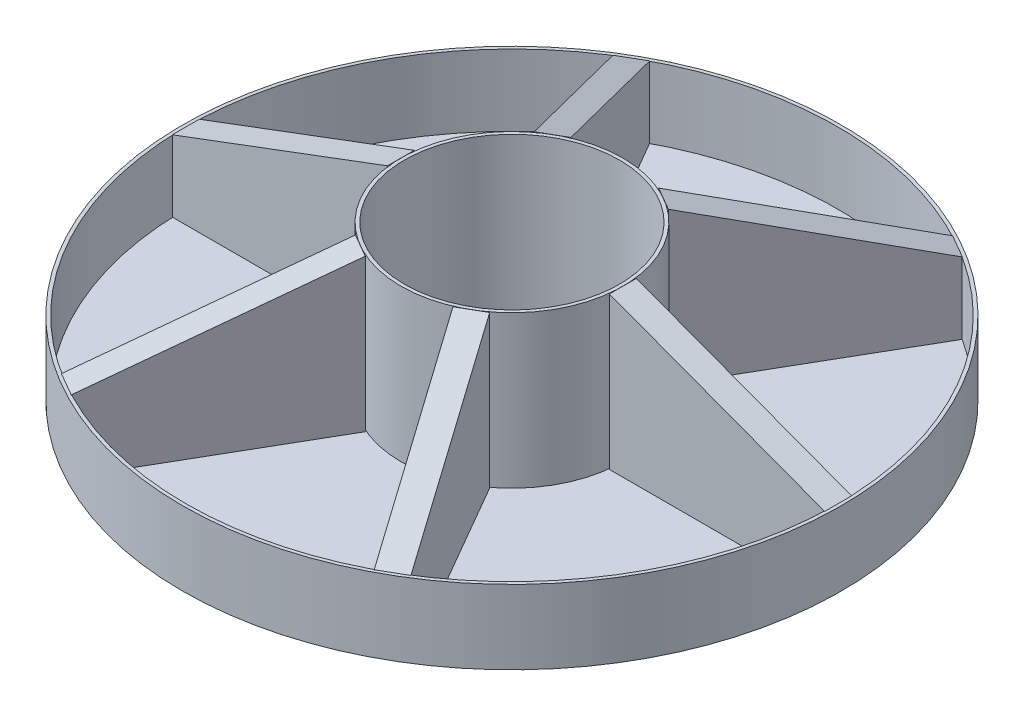
from build123d import *

# Parameters (mm, degrees)
SKETCH1_R           = 4.125
SKETCH1_R_2         = 4
BOSS_EXTRUDE1_DEPTH = 5.75
SKETCH1_4_R         = 12.25
SKETCH1_4_R_2       = 12.125
BOSS_EXTRUDE2_DEPTH = 2.75
SKETCH1_5_R         = 12.125
SKETCH1_5_R_2       = 4.125
BOSS_EXTRUDE3_DEPTH = 0.1
BOSS_EXTRUDE5_DEPTH = 0.5
CIRPATTERN4_COUNT   = 6


with BuildPart() as part:
    # Sketch1 → Boss-Extrude1 (new body)
    with BuildSketch(Plane(origin=(0, 0, 0), x_dir=(1, 0, 0), z_dir=(0, 1, 0))):
        Circle(SKETCH1_R)
        Circle(SKETCH1_R_2, mode=Mode.SUBTRACT)
    extrude(amount=BOSS_EXTRUDE1_DEPTH)



with BuildPart() as body_2:
    # Sketch1<4> → Boss-Extrude2 (new body)
    with BuildSketch(Plane(origin=(0, 0, 0), x_dir=(1, 0, 0), z_dir=(0, 1, 0))):
        Circle(SKETCH1_4_R)
        Circle(SKETCH1_4_R_2, mode=Mode.SUBTRACT)
    extrude(amount=BOSS_EXTRUDE2_DEPTH)


with BuildPart() as part_1:
    add(part.part)

    add(body_2.part)  # Boss-Extrude3 merges body 2
    # Sketch1<5> → Boss-Extrude3 (add)
    with BuildSketch(Plane(origin=(0, 0, 0), x_dir=(1, 0, 0), z_dir=(0, 1, 0))):
        Circle(SKETCH1_5_R)
        Circle(SKETCH1_5_R_2, mode=Mode.SUBTRACT)
    extrude(amount=BOSS_EXTRUDE3_DEPTH)


with BuildPart() as body_2_2:
    # Sketch7 → Boss-Extrude5 (new, symmetric)
    with BuildSketch(Plane.XY):
        Polygon((-4.125, 0.1), (-4.125, 5.75), (-12.125, 2.75), (-12.125, 0.1), align=None)
    extrude(amount=BOSS_EXTRUDE5_DEPTH, both=True)


with BuildPart() as cirpattern4_1:
    # CirPattern4: pattern copy
    add(body_2_2.part.rotate(Axis((0, 5.75, 0), (0, 1, 0)), 1 * 360 / CIRPATTERN4_COUNT))


with BuildPart() as cirpattern4_2:
    # CirPattern4: pattern copy
    add(body_2_2.part.rotate(Axis((0, 5.75, 0), (0, 1, 0)), 2 * 360 / CIRPATTERN4_COUNT))


with BuildPart() as cirpattern4_3:
    # CirPattern4: pattern copy
    add(body_2_2.part.rotate(Axis((0, 5.75, 0), (0, 1, 0)), 3 * 360 / CIRPATTERN4_COUNT))


with BuildPart() as cirpattern4_4:
    # CirPattern4: pattern copy
    add(body_2_2.part.rotate(Axis((0, 5.75, 0), (0, 1, 0)), 4 * 360 / CIRPATTERN4_COUNT))


with BuildPart() as cirpattern4_5:
    # CirPattern4: pattern copy
    add(body_2_2.part.rotate(Axis((0, 5.75, 0), (0, 1, 0)), 5 * 360 / CIRPATTERN4_COUNT))


solid = Compound([part_1.part, body_2_2.part, cirpattern4_1.part, cirpattern4_2.part, cirpattern4_3.part, cirpattern4_4.part, cirpattern4_5.part])
